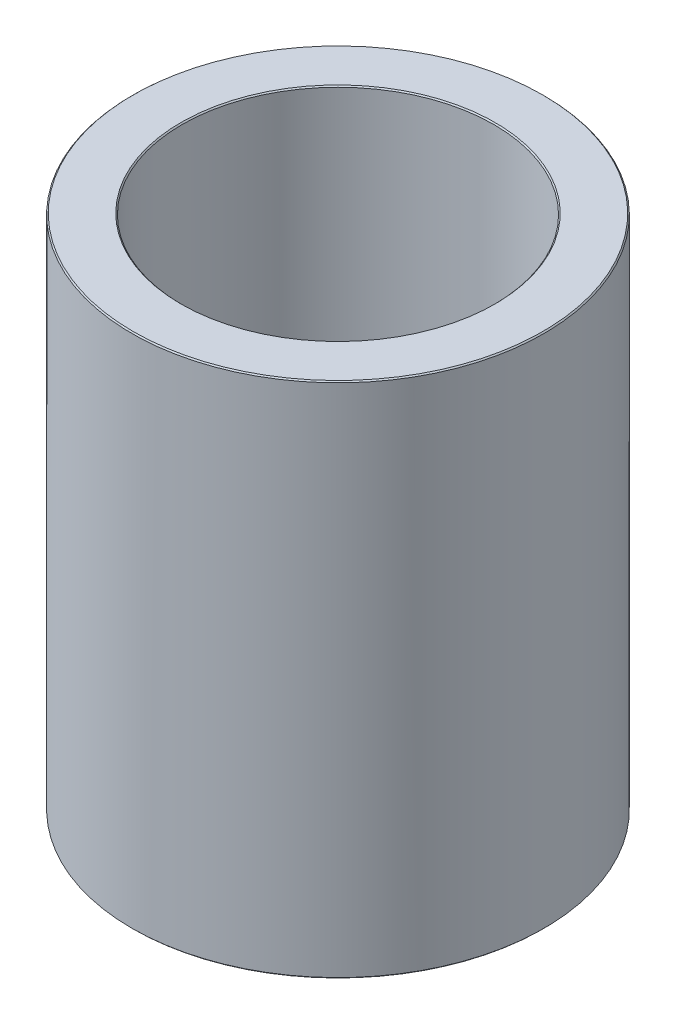
from build123d import *

# Parameters (mm, degrees)
SKETCH1_R           = 45
BOSS_EXTRUDE1_DEPTH = 113.019225057
SKETCH2_R           = 34.067847527
CUT_EXTRUDE1_DEPTH  = 130.704838894
CHAMFER1_SIZE       = 0.255956402


with BuildPart() as part:
    # Sketch1 → Boss-Extrude1 (new body)
    with BuildSketch(Plane(origin=(0, 0, 0), x_dir=(1, 0, 0), z_dir=(0, 1, 0))):
        Circle(SKETCH1_R)
    extrude(amount=BOSS_EXTRUDE1_DEPTH)

    # Sketch2 → Cut-Extrude1 (cut, through all)
    with BuildSketch(Plane(origin=(0, 0, 0), x_dir=(1, 0, 0), z_dir=(0, 1, 0))):
        Circle(SKETCH2_R)
    extrude(amount=CUT_EXTRUDE1_DEPTH, mode=Mode.SUBTRACT)

    # Chamfer1
    chamfer1_edges = [part.edges().sort_by_distance(p)[0] for p in [
        (-34.067847527, 113.019225057, 0),
        (-34.067847527, 0, 0),
        (-45, 0, 0),
        (-45, 113.019225057, 0),
    ]]
    chamfer(chamfer1_edges, length=CHAMFER1_SIZE)


solid = part.part
